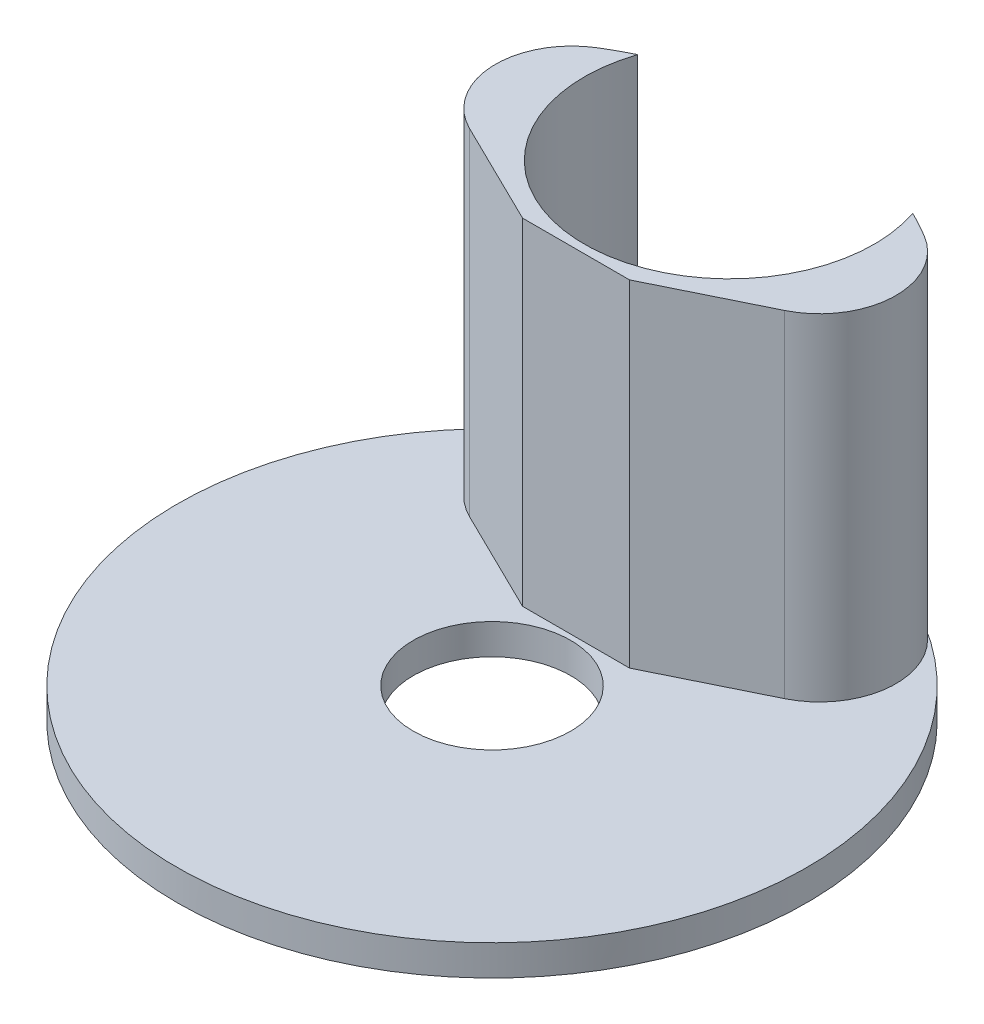
from build123d import *

# Parameters (mm, degrees)
SKETCH1_R           = 20.600000000000005
BOSS_EXTRUDE1_DEPTH = 2
SKETCH2_R           = 5.150000000000001
CUT_EXTRUDE1_DEPTH  = 3
SKETCH3_R           = 6.500000000000001
CUT_EXTRUDE2_DEPTH  = 2
BOSS_EXTRUDE4_DEPTH = 22
FILLET2_R           = 5


with BuildPart() as part:
    # Sketch1 → Boss-Extrude1 (new body)
    with BuildSketch(Plane(origin=(0, 0, 0), x_dir=(1, 0, 0), z_dir=(0, 1, 0))):
        Circle(SKETCH1_R)
    extrude(amount=BOSS_EXTRUDE1_DEPTH)

    # Sketch2 → Cut-Extrude1 (cut)
    with BuildSketch(Plane(origin=(0, 2, 0), x_dir=(1, 0, 0), z_dir=(0, 1, 0))):
        Circle(SKETCH2_R)
    extrude(amount=-CUT_EXTRUDE1_DEPTH, mode=Mode.SUBTRACT)

    # Sketch3 → Cut-Extrude2 (cut)
    with BuildSketch(Plane(origin=(0, 2, 0), x_dir=(1, 0, 0), z_dir=(0, 1, 0))):
        with Locations((0, 13)):
            Circle(SKETCH3_R)
    extrude(amount=-CUT_EXTRUDE2_DEPTH, mode=Mode.SUBTRACT)

    # Sketch4 → Boss-Extrude4 (add)
    with BuildSketch(Plane(origin=(0, 2, 0), x_dir=(1, 0, 0), z_dir=(0, 1, 0))):
        with BuildLine():
            Line((-16.74395413276088, 12), (-3.5000000000000004, 5.5))
            Line((-3.5000000000000004, 5.5), (3.4999999999999996, 5.5))
            Line((3.4999999999999996, 5.5), (16.74395413276088, 12))
            ThreePointArc((16.743954132760877, 12.000000000000005), (13.279606142773188, 15.748398670748102), (9, 18.529975715040756))
            ThreePointArc((9, 18.529975715040756), (-4.4e-16, 6.042759078514694), (-9, 18.529975715040756))
            ThreePointArc((-9.000000000000004, 18.529975715040756), (-13.279606142773194, 15.748398670748106), (-16.74395413276088, 12))
        make_face()
    extrude(amount=BOSS_EXTRUDE4_DEPTH)

    # Fillet2
    fillet2_edges = [part.edges().sort_by_distance(p)[0] for p in [
        (16.74395413276088, 13, -12.000000000000004),
        (-16.743954132760884, 13, -12),
    ]]
    fillet(fillet2_edges, radius=FILLET2_R)


solid = part.part
